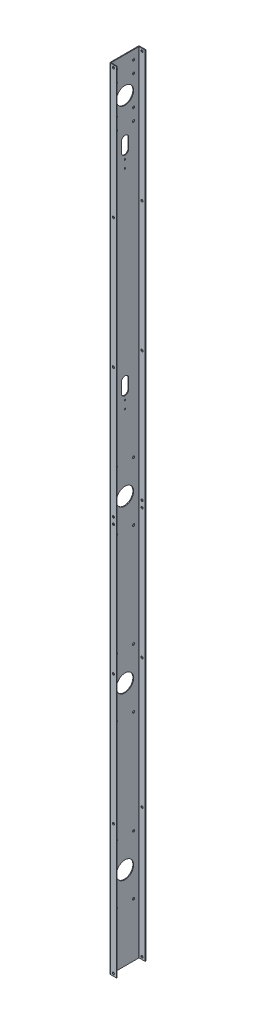
from build123d import *

# Parameters (mm, degrees)
BASE_FLANGE1_DEPTH = 3220
CUT_EXTRUDE1_REACH = 3222.656
SKETCH7_R          = 35
CUT_EXTRUDE2_REACH = 3222.656
SKETCH9_R          = 4.5
LPATTERN1_COUNT    = 3
LPATTERN1_PITCH    = 660
CUT_EXTRUDE3_REACH = 3222.656
SKETCH10_R         = 4.5
CUT_EXTRUDE6_REACH = 3222.656
SKETCH15_R         = 3
LPATTERN2_COUNT    = 2
LPATTERN2_PITCH    = 850
CUT_EXTRUDE7_REACH = 3229.542
SKETCH16_R         = 4.5
LPATTERN3_COUNT    = 4
LPATTERN3_PITCH    = 529


# Sheet-metal steps are written as plain solids
with BuildPart() as part:
    # Sketch2 → Base-Flange1 (new body)
    with BuildSketch(Plane(origin=(0, 0, 0), x_dir=(1, 0, 0), z_dir=(0, 1, 0))):
        with BuildLine():
            Line((185, -57), (161, -57))
            ThreePointArc((161, -57), (160.292893219, -56.707106781), (160, -56))
            Line((160, -56), (160, 56))
            ThreePointArc((160, 56), (160.292893219, 56.707106781), (161, 57))
            Line((161, 57), (185, 57))
            Line((185, 57), (185, 60))
            Line((185, 60), (161, 60))
            ThreePointArc((161, 60), (158.171572875, 58.828427125), (157, 56))
            Line((157, 56), (157, -56))
            ThreePointArc((157, -56), (158.171572875, -58.828427125), (161, -60))
            Line((161, -60), (185, -60))
            Line((185, -60), (185, -57))
        make_face()
    extrude(amount=BASE_FLANGE1_DEPTH)

    # Sketch7 → Cut-Extrude1 (cut, up to next)
    with BuildSketch(Plane(origin=(160, 0, 0), x_dir=(0, 0, -1), z_dir=(1, 0, 0)), mode=Mode.PRIVATE) as cut_extrude1_sk1:
        with Locations((0, 340)):
            Circle(SKETCH7_R)
    cut_extrude1_tool1 = extrude(cut_extrude1_sk1.sketch, amount=-CUT_EXTRUDE1_REACH, mode=Mode.PRIVATE) & part.part
    # Sketch7 → Cut-Extrude1 (cut, up to next)
    with BuildSketch(Plane(origin=(160, 0, 0), x_dir=(0, 0, -1), z_dir=(1, 0, 0)), mode=Mode.PRIVATE) as cut_extrude1_sk2:
        with Locations((0, 1000)):
            Circle(SKETCH7_R)
    cut_extrude1_tool2 = extrude(cut_extrude1_sk2.sketch, amount=-CUT_EXTRUDE1_REACH, mode=Mode.PRIVATE) & part.part
    # Sketch7 → Cut-Extrude1 (cut, up to next)
    with BuildSketch(Plane(origin=(160, 0, 0), x_dir=(0, 0, -1), z_dir=(1, 0, 0)), mode=Mode.PRIVATE) as cut_extrude1_sk3:
        with Locations((0, 1660)):
            Circle(SKETCH7_R)
    cut_extrude1_tool3 = extrude(cut_extrude1_sk3.sketch, amount=-CUT_EXTRUDE1_REACH, mode=Mode.PRIVATE) & part.part
    # Sketch7 → Cut-Extrude1 (cut, up to next)
    with BuildSketch(Plane(origin=(160, 0, 0), x_dir=(0, 0, -1), z_dir=(1, 0, 0)), mode=Mode.PRIVATE) as cut_extrude1_sk4:
        with Locations((0, 3076)):
            Circle(SKETCH7_R)
    cut_extrude1_tool4 = extrude(cut_extrude1_sk4.sketch, amount=-CUT_EXTRUDE1_REACH, mode=Mode.PRIVATE) & part.part
    add(cut_extrude1_tool1.solids().sort_by_distance((160, 340, 0))[0], mode=Mode.SUBTRACT)
    add(cut_extrude1_tool2.solids().sort_by_distance((160, 1000, 0))[0], mode=Mode.SUBTRACT)
    add(cut_extrude1_tool3.solids().sort_by_distance((160, 1660, 0))[0], mode=Mode.SUBTRACT)
    add(cut_extrude1_tool4.solids().sort_by_distance((160, 3076, 0))[0], mode=Mode.SUBTRACT)

    # Sketch9 → Cut-Extrude2 (cut, up to next)
    with BuildSketch(Plane(origin=(160, 0, 0), x_dir=(0, 0, -1), z_dir=(1, 0, 0)), mode=Mode.PRIVATE) as cut_extrude2_sk1:
        with Locations((-35, 460)):
            Circle(SKETCH9_R)
    cut_extrude2_tool1 = extrude(cut_extrude2_sk1.sketch, amount=-CUT_EXTRUDE2_REACH, mode=Mode.PRIVATE) & part.part
    # Sketch9 → Cut-Extrude2 (cut, up to next)
    with BuildSketch(Plane(origin=(160, 0, 0), x_dir=(0, 0, -1), z_dir=(1, 0, 0)), mode=Mode.PRIVATE) as cut_extrude2_sk2:
        with Locations((35, 460)):
            Circle(SKETCH9_R)
    cut_extrude2_tool2 = extrude(cut_extrude2_sk2.sketch, amount=-CUT_EXTRUDE2_REACH, mode=Mode.PRIVATE) & part.part
    # Sketch9 → Cut-Extrude2 (cut, up to next)
    with BuildSketch(Plane(origin=(160, 0, 0), x_dir=(0, 0, -1), z_dir=(1, 0, 0)), mode=Mode.PRIVATE) as cut_extrude2_sk3:
        with Locations((-35, 220)):
            Circle(SKETCH9_R)
    cut_extrude2_tool3 = extrude(cut_extrude2_sk3.sketch, amount=-CUT_EXTRUDE2_REACH, mode=Mode.PRIVATE) & part.part
    # Sketch9 → Cut-Extrude2 (cut, up to next)
    with BuildSketch(Plane(origin=(160, 0, 0), x_dir=(0, 0, -1), z_dir=(1, 0, 0)), mode=Mode.PRIVATE) as cut_extrude2_sk4:
        with Locations((35, 220)):
            Circle(SKETCH9_R)
    cut_extrude2_tool4 = extrude(cut_extrude2_sk4.sketch, amount=-CUT_EXTRUDE2_REACH, mode=Mode.PRIVATE) & part.part
    cut_extrude2_1 = cut_extrude2_tool1.solids().sort_by_distance((160, 460, 35))[0]
    add(cut_extrude2_1, mode=Mode.SUBTRACT)
    cut_extrude2_2 = cut_extrude2_tool2.solids().sort_by_distance((160, 460, -35))[0]
    add(cut_extrude2_2, mode=Mode.SUBTRACT)
    cut_extrude2_3 = cut_extrude2_tool3.solids().sort_by_distance((160, 220, 35))[0]
    add(cut_extrude2_3, mode=Mode.SUBTRACT)
    cut_extrude2_4 = cut_extrude2_tool4.solids().sort_by_distance((160, 220, -35))[0]
    add(cut_extrude2_4, mode=Mode.SUBTRACT)
    cut_extrude2 = cut_extrude2_1 + cut_extrude2_2 + cut_extrude2_3 + cut_extrude2_4  # Cut-Extrude2 as one shape, for the pattern or mirror that repeats it

    # LPattern1: Cut-Extrude2 ×3
    with Locations(*[(0, i * LPATTERN1_PITCH, 0) for i in range(1, LPATTERN1_COUNT)]):
        add(cut_extrude2, mode=Mode.SUBTRACT)

    # Sketch10 → Cut-Extrude3 (cut, up to next)
    with BuildSketch(Plane(origin=(160, 0, 0), x_dir=(0, 0, -1), z_dir=(1, 0, 0)), mode=Mode.PRIVATE) as cut_extrude3_sk1:
        with Locations((-35, 3016)):
            Circle(SKETCH10_R)
    cut_extrude3_tool1 = extrude(cut_extrude3_sk1.sketch, amount=-CUT_EXTRUDE3_REACH, mode=Mode.PRIVATE) & part.part
    # Sketch10 → Cut-Extrude3 (cut, up to next)
    with BuildSketch(Plane(origin=(160, 0, 0), x_dir=(0, 0, -1), z_dir=(1, 0, 0)), mode=Mode.PRIVATE) as cut_extrude3_sk2:
        with Locations((35, 3016)):
            Circle(SKETCH10_R)
    cut_extrude3_tool2 = extrude(cut_extrude3_sk2.sketch, amount=-CUT_EXTRUDE3_REACH, mode=Mode.PRIVATE) & part.part
    # Sketch10 → Cut-Extrude3 (cut, up to next)
    with BuildSketch(Plane(origin=(160, 0, 0), x_dir=(0, 0, -1), z_dir=(1, 0, 0)), mode=Mode.PRIVATE) as cut_extrude3_sk3:
        with Locations((-35, 3136)):
            Circle(SKETCH10_R)
    cut_extrude3_tool3 = extrude(cut_extrude3_sk3.sketch, amount=-CUT_EXTRUDE3_REACH, mode=Mode.PRIVATE) & part.part
    # Sketch10 → Cut-Extrude3 (cut, up to next)
    with BuildSketch(Plane(origin=(160, 0, 0), x_dir=(0, 0, -1), z_dir=(1, 0, 0)), mode=Mode.PRIVATE) as cut_extrude3_sk4:
        with Locations((35, 3136)):
            Circle(SKETCH10_R)
    cut_extrude3_tool4 = extrude(cut_extrude3_sk4.sketch, amount=-CUT_EXTRUDE3_REACH, mode=Mode.PRIVATE) & part.part
    # Sketch10 → Cut-Extrude3 (cut, up to next)
    with BuildSketch(Plane(origin=(160, 0, 0), x_dir=(0, 0, -1), z_dir=(1, 0, 0)), mode=Mode.PRIVATE) as cut_extrude3_sk5:
        with Locations((-35, 3184)):
            Circle(SKETCH10_R)
    cut_extrude3_tool5 = extrude(cut_extrude3_sk5.sketch, amount=-CUT_EXTRUDE3_REACH, mode=Mode.PRIVATE) & part.part
    # Sketch10 → Cut-Extrude3 (cut, up to next)
    with BuildSketch(Plane(origin=(160, 0, 0), x_dir=(0, 0, -1), z_dir=(1, 0, 0)), mode=Mode.PRIVATE) as cut_extrude3_sk6:
        with Locations((35, 3184)):
            Circle(SKETCH10_R)
    cut_extrude3_tool6 = extrude(cut_extrude3_sk6.sketch, amount=-CUT_EXTRUDE3_REACH, mode=Mode.PRIVATE) & part.part
    # Sketch10 → Cut-Extrude3 (cut, up to next)
    with BuildSketch(Plane(origin=(160, 0, 0), x_dir=(0, 0, -1), z_dir=(1, 0, 0)), mode=Mode.PRIVATE) as cut_extrude3_sk7:
        with Locations((-35, 2968)):
            Circle(SKETCH10_R)
    cut_extrude3_tool7 = extrude(cut_extrude3_sk7.sketch, amount=-CUT_EXTRUDE3_REACH, mode=Mode.PRIVATE) & part.part
    # Sketch10 → Cut-Extrude3 (cut, up to next)
    with BuildSketch(Plane(origin=(160, 0, 0), x_dir=(0, 0, -1), z_dir=(1, 0, 0)), mode=Mode.PRIVATE) as cut_extrude3_sk8:
        with Locations((35, 2968)):
            Circle(SKETCH10_R)
    cut_extrude3_tool8 = extrude(cut_extrude3_sk8.sketch, amount=-CUT_EXTRUDE3_REACH, mode=Mode.PRIVATE) & part.part
    add(cut_extrude3_tool1.solids().sort_by_distance((160, 3016, 35))[0], mode=Mode.SUBTRACT)
    add(cut_extrude3_tool2.solids().sort_by_distance((160, 3016, -35))[0], mode=Mode.SUBTRACT)
    add(cut_extrude3_tool3.solids().sort_by_distance((160, 3136, 35))[0], mode=Mode.SUBTRACT)
    add(cut_extrude3_tool4.solids().sort_by_distance((160, 3136, -35))[0], mode=Mode.SUBTRACT)
    add(cut_extrude3_tool5.solids().sort_by_distance((160, 3184, 35))[0], mode=Mode.SUBTRACT)
    add(cut_extrude3_tool6.solids().sort_by_distance((160, 3184, -35))[0], mode=Mode.SUBTRACT)
    add(cut_extrude3_tool7.solids().sort_by_distance((160, 2968, 35))[0], mode=Mode.SUBTRACT)
    add(cut_extrude3_tool8.solids().sort_by_distance((160, 2968, -35))[0], mode=Mode.SUBTRACT)

    # Sketch15 → Cut-Extrude6 (cut, up to next)
    with BuildSketch(Plane(origin=(160, 0, 0), x_dir=(0, 0, -1), z_dir=(1, 0, 0)), mode=Mode.PRIVATE) as cut_extrude6_sk1:
        with Locations((0, 2000)):
            Circle(SKETCH15_R)
    cut_extrude6_tool1 = extrude(cut_extrude6_sk1.sketch, amount=-CUT_EXTRUDE6_REACH, mode=Mode.PRIVATE) & part.part
    # Sketch15 → Cut-Extrude6 (cut, up to next)
    with BuildSketch(Plane(origin=(160, 0, 0), x_dir=(0, 0, -1), z_dir=(1, 0, 0)), mode=Mode.PRIVATE) as cut_extrude6_sk2:
        with Locations((0, 1968)):
            Circle(SKETCH15_R)
    cut_extrude6_tool2 = extrude(cut_extrude6_sk2.sketch, amount=-CUT_EXTRUDE6_REACH, mode=Mode.PRIVATE) & part.part
    # Sketch15 → Cut-Extrude6 (cut, up to next)
    with BuildSketch(Plane(origin=(160, 0, 0), x_dir=(0, 0, -1), z_dir=(1, 0, 0)), mode=Mode.PRIVATE) as cut_extrude6_sk3:
        with BuildLine():
            Line((-15, 2030), (-15, 2070))
            ThreePointArc((-15, 2070), (0, 2085), (15, 2070))
            Line((15, 2070), (15, 2030))
            ThreePointArc((15, 2030), (0, 2015), (-15, 2030))
        make_face()
    cut_extrude6_tool3 = extrude(cut_extrude6_sk3.sketch, amount=-CUT_EXTRUDE6_REACH, mode=Mode.PRIVATE) & part.part
    cut_extrude6_1 = cut_extrude6_tool1.solids().sort_by_distance((160, 2000, 0))[0]
    add(cut_extrude6_1, mode=Mode.SUBTRACT)
    cut_extrude6_2 = cut_extrude6_tool2.solids().sort_by_distance((160, 1968, 0))[0]
    add(cut_extrude6_2, mode=Mode.SUBTRACT)
    cut_extrude6_3 = cut_extrude6_tool3.solids().sort_by_distance((160, 2050, 0))[0]
    add(cut_extrude6_3, mode=Mode.SUBTRACT)
    cut_extrude6 = cut_extrude6_1 + cut_extrude6_2 + cut_extrude6_3  # Cut-Extrude6 as one shape, for the pattern or mirror that repeats it

    # LPattern2: Cut-Extrude6 ×2
    with Locations(*[(0, i * LPATTERN2_PITCH, 0) for i in range(1, LPATTERN2_COUNT)]):
        add(cut_extrude6, mode=Mode.SUBTRACT)

    # Cut-Extrude7: up to this face of the body (flat: up to its plane)
    cut_extrude7_end = Plane(part.part.faces().sort_by_distance((173, 1610, 60))[0])
    # Sketch16 → Cut-Extrude7 (cut, up to the picked face)
    with BuildSketch(Plane(origin=(0, 0, -60), x_dir=(-1, 0, 0), z_dir=(0, 0, -1)), mode=Mode.PRIVATE) as cut_extrude7_sk1:
        with Locations((-172.5, 10)):
            Circle(SKETCH16_R)
    cut_extrude7_tool1 = split(extrude(cut_extrude7_sk1.sketch, amount=-CUT_EXTRUDE7_REACH, mode=Mode.PRIVATE), bisect_by=cut_extrude7_end, keep=Keep.BOTH, mode=Mode.PRIVATE)
    # Sketch16 → Cut-Extrude7 (cut, up to the picked face)
    with BuildSketch(Plane(origin=(0, 0, -60), x_dir=(-1, 0, 0), z_dir=(0, 0, -1)), mode=Mode.PRIVATE) as cut_extrude7_sk2:
        with Locations((-172.5, 1623)):
            Circle(SKETCH16_R)
    cut_extrude7_tool2 = split(extrude(cut_extrude7_sk2.sketch, amount=-CUT_EXTRUDE7_REACH, mode=Mode.PRIVATE), bisect_by=cut_extrude7_end, keep=Keep.BOTH, mode=Mode.PRIVATE)
    cut_extrude7_1 = cut_extrude7_tool1.solids().sort_by(Axis((172.5, 10, -60), (0, 0, 1)))[0]
    add(cut_extrude7_1, mode=Mode.SUBTRACT)
    cut_extrude7_2 = cut_extrude7_tool2.solids().sort_by(Axis((172.5, 1623, -60), (0, 0, 1)))[0]
    add(cut_extrude7_2, mode=Mode.SUBTRACT)
    cut_extrude7 = cut_extrude7_1 + cut_extrude7_2  # Cut-Extrude7 as one shape, for the pattern or mirror that repeats it

    # LPattern3: Cut-Extrude7 ×4
    with Locations(*[(0, i * LPATTERN3_PITCH, 0) for i in range(1, LPATTERN3_COUNT)]):
        add(cut_extrude7, mode=Mode.SUBTRACT)


solid = part.part
